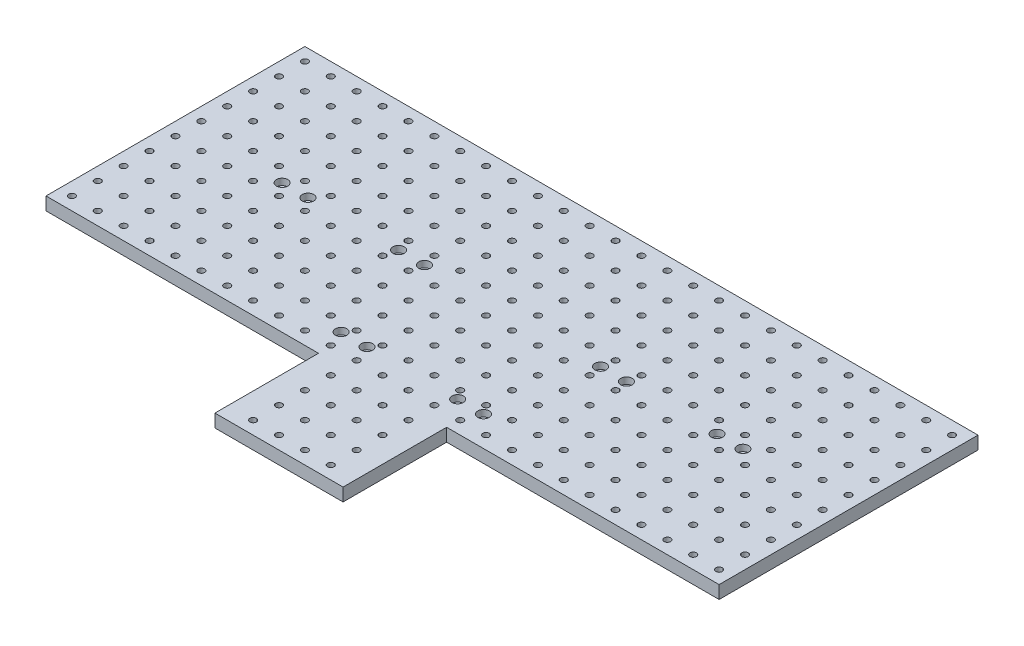
from build123d import *

# Parameters (mm, degrees)
SKETCH1_R           = 3.175
BOSS_EXTRUDE1_DEPTH = 12.7
SKETCH2_R           = 5.588
SKETCH2_R_2         = 3.175
CUT_EXTRUDE1_DEPTH  = 6.35
SKETCH2_2_R         = 3.175
CUT_EXTRUDE2_DEPTH  = 12.7
SKETCH3_R           = 5.588
SKETCH3_R_2         = 3.175
CUT_EXTRUDE3_DEPTH  = 6.35
SKETCH3_2_R         = 3.175
CUT_EXTRUDE4_DEPTH  = 12.7


with BuildPart() as part:
    # Sketch1 → Boss-Extrude1 (new body)
    with BuildSketch(Plane(origin=(0, 0, 0), x_dir=(1, 0, 0), z_dir=(0, 1, 0))):
        Polygon((393.065, 0), (660.4, 0), (660.4, 254), (0, 254), (0, 0), (267.335, 0), (267.335, -101.6), (393.065, -101.6), align=None)
        with Locations((12.7, 241.3)):
            Circle(SKETCH1_R, mode=Mode.SUBTRACT)
        with Locations((38.1, 241.3)):
            Circle(SKETCH1_R, mode=Mode.SUBTRACT)
        with Locations((63.5, 241.3)):
            Circle(SKETCH1_R, mode=Mode.SUBTRACT)
        with Locations((88.9, 241.3)):
            Circle(SKETCH1_R, mode=Mode.SUBTRACT)
        with Locations((114.3, 241.3)):
            Circle(SKETCH1_R, mode=Mode.SUBTRACT)
        with Locations((139.7, 241.3)):
            Circle(SKETCH1_R, mode=Mode.SUBTRACT)
        with Locations((165.1, 241.3)):
            Circle(SKETCH1_R, mode=Mode.SUBTRACT)
        with Locations((190.5, 241.3)):
            Circle(SKETCH1_R, mode=Mode.SUBTRACT)
        with Locations((215.9, 241.3)):
            Circle(SKETCH1_R, mode=Mode.SUBTRACT)
        with Locations((241.3, 241.3)):
            Circle(SKETCH1_R, mode=Mode.SUBTRACT)
        with Locations((266.7, 241.3)):
            Circle(SKETCH1_R, mode=Mode.SUBTRACT)
        with Locations((292.1, 241.3)):
            Circle(SKETCH1_R, mode=Mode.SUBTRACT)
        with Locations((317.5, 241.3)):
            Circle(SKETCH1_R, mode=Mode.SUBTRACT)
        with Locations((342.9, 241.3)):
            Circle(SKETCH1_R, mode=Mode.SUBTRACT)
        with Locations((368.3, 241.3)):
            Circle(SKETCH1_R, mode=Mode.SUBTRACT)
        with Locations((393.7, 241.3)):
            Circle(SKETCH1_R, mode=Mode.SUBTRACT)
        with Locations((419.1, 241.3)):
            Circle(SKETCH1_R, mode=Mode.SUBTRACT)
        with Locations((444.5, 241.3)):
            Circle(SKETCH1_R, mode=Mode.SUBTRACT)
        with Locations((469.9, 241.3)):
            Circle(SKETCH1_R, mode=Mode.SUBTRACT)
        with Locations((495.3, 241.3)):
            Circle(SKETCH1_R, mode=Mode.SUBTRACT)
        with Locations((520.7, 241.3)):
            Circle(SKETCH1_R, mode=Mode.SUBTRACT)
        with Locations((546.1, 241.3)):
            Circle(SKETCH1_R, mode=Mode.SUBTRACT)
        with Locations((571.5, 241.3)):
            Circle(SKETCH1_R, mode=Mode.SUBTRACT)
        with Locations((596.9, 241.3)):
            Circle(SKETCH1_R, mode=Mode.SUBTRACT)
        with Locations((622.3, 241.3)):
            Circle(SKETCH1_R, mode=Mode.SUBTRACT)
        with Locations((647.7, 241.3)):
            Circle(SKETCH1_R, mode=Mode.SUBTRACT)
        with Locations((38.1, 215.9)):
            Circle(SKETCH1_R, mode=Mode.SUBTRACT)
        with Locations((63.5, 215.9)):
            Circle(SKETCH1_R, mode=Mode.SUBTRACT)
        with Locations((88.9, 215.9)):
            Circle(SKETCH1_R, mode=Mode.SUBTRACT)
        with Locations((114.3, 215.9)):
            Circle(SKETCH1_R, mode=Mode.SUBTRACT)
        with Locations((139.7, 215.9)):
            Circle(SKETCH1_R, mode=Mode.SUBTRACT)
        with Locations((165.1, 215.9)):
            Circle(SKETCH1_R, mode=Mode.SUBTRACT)
        with Locations((190.5, 215.9)):
            Circle(SKETCH1_R, mode=Mode.SUBTRACT)
        with Locations((215.9, 215.9)):
            Circle(SKETCH1_R, mode=Mode.SUBTRACT)
        with Locations((241.3, 215.9)):
            Circle(SKETCH1_R, mode=Mode.SUBTRACT)
        with Locations((266.7, 215.9)):
            Circle(SKETCH1_R, mode=Mode.SUBTRACT)
        with Locations((292.1, 215.9)):
            Circle(SKETCH1_R, mode=Mode.SUBTRACT)
        with Locations((317.5, 215.9)):
            Circle(SKETCH1_R, mode=Mode.SUBTRACT)
        with Locations((342.9, 215.9)):
            Circle(SKETCH1_R, mode=Mode.SUBTRACT)
        with Locations((368.3, 215.9)):
            Circle(SKETCH1_R, mode=Mode.SUBTRACT)
        with Locations((393.7, 215.9)):
            Circle(SKETCH1_R, mode=Mode.SUBTRACT)
        with Locations((419.1, 215.9)):
            Circle(SKETCH1_R, mode=Mode.SUBTRACT)
        with Locations((444.5, 215.9)):
            Circle(SKETCH1_R, mode=Mode.SUBTRACT)
        with Locations((469.9, 215.9)):
            Circle(SKETCH1_R, mode=Mode.SUBTRACT)
        with Locations((495.3, 215.9)):
            Circle(SKETCH1_R, mode=Mode.SUBTRACT)
        with Locations((520.7, 215.9)):
            Circle(SKETCH1_R, mode=Mode.SUBTRACT)
        with Locations((546.1, 215.9)):
            Circle(SKETCH1_R, mode=Mode.SUBTRACT)
        with Locations((571.5, 215.9)):
            Circle(SKETCH1_R, mode=Mode.SUBTRACT)
        with Locations((596.9, 215.9)):
            Circle(SKETCH1_R, mode=Mode.SUBTRACT)
        with Locations((622.3, 215.9)):
            Circle(SKETCH1_R, mode=Mode.SUBTRACT)
        with Locations((647.7, 215.9)):
            Circle(SKETCH1_R, mode=Mode.SUBTRACT)
        with Locations((38.1, 190.5)):
            Circle(SKETCH1_R, mode=Mode.SUBTRACT)
        with Locations((63.5, 190.5)):
            Circle(SKETCH1_R, mode=Mode.SUBTRACT)
        with Locations((88.9, 190.5)):
            Circle(SKETCH1_R, mode=Mode.SUBTRACT)
        with Locations((114.3, 190.5)):
            Circle(SKETCH1_R, mode=Mode.SUBTRACT)
        with Locations((139.7, 190.5)):
            Circle(SKETCH1_R, mode=Mode.SUBTRACT)
        with Locations((165.1, 190.5)):
            Circle(SKETCH1_R, mode=Mode.SUBTRACT)
        with Locations((190.5, 190.5)):
            Circle(SKETCH1_R, mode=Mode.SUBTRACT)
        with Locations((215.9, 190.5)):
            Circle(SKETCH1_R, mode=Mode.SUBTRACT)
        with Locations((241.3, 190.5)):
            Circle(SKETCH1_R, mode=Mode.SUBTRACT)
        with Locations((266.7, 190.5)):
            Circle(SKETCH1_R, mode=Mode.SUBTRACT)
        with Locations((292.1, 190.5)):
            Circle(SKETCH1_R, mode=Mode.SUBTRACT)
        with Locations((317.5, 190.5)):
            Circle(SKETCH1_R, mode=Mode.SUBTRACT)
        with Locations((342.9, 190.5)):
            Circle(SKETCH1_R, mode=Mode.SUBTRACT)
        with Locations((368.3, 190.5)):
            Circle(SKETCH1_R, mode=Mode.SUBTRACT)
        with Locations((393.7, 190.5)):
            Circle(SKETCH1_R, mode=Mode.SUBTRACT)
        with Locations((419.1, 190.5)):
            Circle(SKETCH1_R, mode=Mode.SUBTRACT)
        with Locations((444.5, 190.5)):
            Circle(SKETCH1_R, mode=Mode.SUBTRACT)
        with Locations((469.9, 190.5)):
            Circle(SKETCH1_R, mode=Mode.SUBTRACT)
        with Locations((495.3, 190.5)):
            Circle(SKETCH1_R, mode=Mode.SUBTRACT)
        with Locations((520.7, 190.5)):
            Circle(SKETCH1_R, mode=Mode.SUBTRACT)
        with Locations((546.1, 190.5)):
            Circle(SKETCH1_R, mode=Mode.SUBTRACT)
        with Locations((571.5, 190.5)):
            Circle(SKETCH1_R, mode=Mode.SUBTRACT)
        with Locations((596.9, 190.5)):
            Circle(SKETCH1_R, mode=Mode.SUBTRACT)
        with Locations((622.3, 190.5)):
            Circle(SKETCH1_R, mode=Mode.SUBTRACT)
        with Locations((647.7, 190.5)):
            Circle(SKETCH1_R, mode=Mode.SUBTRACT)
        with Locations((38.1, 165.1)):
            Circle(SKETCH1_R, mode=Mode.SUBTRACT)
        with Locations((63.5, 165.1)):
            Circle(SKETCH1_R, mode=Mode.SUBTRACT)
        with Locations((88.9, 165.1)):
            Circle(SKETCH1_R, mode=Mode.SUBTRACT)
        with Locations((114.3, 165.1)):
            Circle(SKETCH1_R, mode=Mode.SUBTRACT)
        with Locations((139.7, 165.1)):
            Circle(SKETCH1_R, mode=Mode.SUBTRACT)
        with Locations((165.1, 165.1)):
            Circle(SKETCH1_R, mode=Mode.SUBTRACT)
        with Locations((190.5, 165.1)):
            Circle(SKETCH1_R, mode=Mode.SUBTRACT)
        with Locations((215.9, 165.1)):
            Circle(SKETCH1_R, mode=Mode.SUBTRACT)
        with Locations((241.3, 165.1)):
            Circle(SKETCH1_R, mode=Mode.SUBTRACT)
        with Locations((266.7, 165.1)):
            Circle(SKETCH1_R, mode=Mode.SUBTRACT)
        with Locations((292.1, 165.1)):
            Circle(SKETCH1_R, mode=Mode.SUBTRACT)
        with Locations((317.5, 165.1)):
            Circle(SKETCH1_R, mode=Mode.SUBTRACT)
        with Locations((342.9, 165.1)):
            Circle(SKETCH1_R, mode=Mode.SUBTRACT)
        with Locations((368.3, 165.1)):
            Circle(SKETCH1_R, mode=Mode.SUBTRACT)
        with Locations((393.7, 165.1)):
            Circle(SKETCH1_R, mode=Mode.SUBTRACT)
        with Locations((419.1, 165.1)):
            Circle(SKETCH1_R, mode=Mode.SUBTRACT)
        with Locations((444.5, 165.1)):
            Circle(SKETCH1_R, mode=Mode.SUBTRACT)
        with Locations((469.9, 165.1)):
            Circle(SKETCH1_R, mode=Mode.SUBTRACT)
        with Locations((495.3, 165.1)):
            Circle(SKETCH1_R, mode=Mode.SUBTRACT)
        with Locations((520.7, 165.1)):
            Circle(SKETCH1_R, mode=Mode.SUBTRACT)
        with Locations((546.1, 165.1)):
            Circle(SKETCH1_R, mode=Mode.SUBTRACT)
        with Locations((571.5, 165.1)):
            Circle(SKETCH1_R, mode=Mode.SUBTRACT)
        with Locations((596.9, 165.1)):
            Circle(SKETCH1_R, mode=Mode.SUBTRACT)
        with Locations((622.3, 165.1)):
            Circle(SKETCH1_R, mode=Mode.SUBTRACT)
        with Locations((647.7, 165.1)):
            Circle(SKETCH1_R, mode=Mode.SUBTRACT)
        with Locations((38.1, 139.7)):
            Circle(SKETCH1_R, mode=Mode.SUBTRACT)
        with Locations((63.5, 139.7)):
            Circle(SKETCH1_R, mode=Mode.SUBTRACT)
        with Locations((88.9, 139.7)):
            Circle(SKETCH1_R, mode=Mode.SUBTRACT)
        with Locations((114.3, 139.7)):
            Circle(SKETCH1_R, mode=Mode.SUBTRACT)
        with Locations((139.7, 139.7)):
            Circle(SKETCH1_R, mode=Mode.SUBTRACT)
        with Locations((165.1, 139.7)):
            Circle(SKETCH1_R, mode=Mode.SUBTRACT)
        with Locations((190.5, 139.7)):
            Circle(SKETCH1_R, mode=Mode.SUBTRACT)
        with Locations((215.9, 139.7)):
            Circle(SKETCH1_R, mode=Mode.SUBTRACT)
        with Locations((241.3, 139.7)):
            Circle(SKETCH1_R, mode=Mode.SUBTRACT)
        with Locations((266.7, 139.7)):
            Circle(SKETCH1_R, mode=Mode.SUBTRACT)
        with Locations((292.1, 139.7)):
            Circle(SKETCH1_R, mode=Mode.SUBTRACT)
        with Locations((317.5, 139.7)):
            Circle(SKETCH1_R, mode=Mode.SUBTRACT)
        with Locations((342.9, 139.7)):
            Circle(SKETCH1_R, mode=Mode.SUBTRACT)
        with Locations((368.3, 139.7)):
            Circle(SKETCH1_R, mode=Mode.SUBTRACT)
        with Locations((393.7, 139.7)):
            Circle(SKETCH1_R, mode=Mode.SUBTRACT)
        with Locations((419.1, 139.7)):
            Circle(SKETCH1_R, mode=Mode.SUBTRACT)
        with Locations((444.5, 139.7)):
            Circle(SKETCH1_R, mode=Mode.SUBTRACT)
        with Locations((469.9, 139.7)):
            Circle(SKETCH1_R, mode=Mode.SUBTRACT)
        with Locations((495.3, 139.7)):
            Circle(SKETCH1_R, mode=Mode.SUBTRACT)
        with Locations((520.7, 139.7)):
            Circle(SKETCH1_R, mode=Mode.SUBTRACT)
        with Locations((546.1, 139.7)):
            Circle(SKETCH1_R, mode=Mode.SUBTRACT)
        with Locations((571.5, 139.7)):
            Circle(SKETCH1_R, mode=Mode.SUBTRACT)
        with Locations((596.9, 139.7)):
            Circle(SKETCH1_R, mode=Mode.SUBTRACT)
        with Locations((622.3, 139.7)):
            Circle(SKETCH1_R, mode=Mode.SUBTRACT)
        with Locations((647.7, 139.7)):
            Circle(SKETCH1_R, mode=Mode.SUBTRACT)
        with Locations((38.1, 114.3)):
            Circle(SKETCH1_R, mode=Mode.SUBTRACT)
        with Locations((63.5, 114.3)):
            Circle(SKETCH1_R, mode=Mode.SUBTRACT)
        with Locations((88.9, 114.3)):
            Circle(SKETCH1_R, mode=Mode.SUBTRACT)
        with Locations((114.3, 114.3)):
            Circle(SKETCH1_R, mode=Mode.SUBTRACT)
        with Locations((139.7, 114.3)):
            Circle(SKETCH1_R, mode=Mode.SUBTRACT)
        with Locations((165.1, 114.3)):
            Circle(SKETCH1_R, mode=Mode.SUBTRACT)
        with Locations((190.5, 114.3)):
            Circle(SKETCH1_R, mode=Mode.SUBTRACT)
        with Locations((215.9, 114.3)):
            Circle(SKETCH1_R, mode=Mode.SUBTRACT)
        with Locations((241.3, 114.3)):
            Circle(SKETCH1_R, mode=Mode.SUBTRACT)
        with Locations((266.7, 114.3)):
            Circle(SKETCH1_R, mode=Mode.SUBTRACT)
        with Locations((292.1, 114.3)):
            Circle(SKETCH1_R, mode=Mode.SUBTRACT)
        with Locations((317.5, 114.3)):
            Circle(SKETCH1_R, mode=Mode.SUBTRACT)
        with Locations((342.9, 114.3)):
            Circle(SKETCH1_R, mode=Mode.SUBTRACT)
        with Locations((368.3, 114.3)):
            Circle(SKETCH1_R, mode=Mode.SUBTRACT)
        with Locations((393.7, 114.3)):
            Circle(SKETCH1_R, mode=Mode.SUBTRACT)
        with Locations((419.1, 114.3)):
            Circle(SKETCH1_R, mode=Mode.SUBTRACT)
        with Locations((444.5, 114.3)):
            Circle(SKETCH1_R, mode=Mode.SUBTRACT)
        with Locations((469.9, 114.3)):
            Circle(SKETCH1_R, mode=Mode.SUBTRACT)
        with Locations((495.3, 114.3)):
            Circle(SKETCH1_R, mode=Mode.SUBTRACT)
        with Locations((520.7, 114.3)):
            Circle(SKETCH1_R, mode=Mode.SUBTRACT)
        with Locations((546.1, 114.3)):
            Circle(SKETCH1_R, mode=Mode.SUBTRACT)
        with Locations((571.5, 114.3)):
            Circle(SKETCH1_R, mode=Mode.SUBTRACT)
        with Locations((596.9, 114.3)):
            Circle(SKETCH1_R, mode=Mode.SUBTRACT)
        with Locations((622.3, 114.3)):
            Circle(SKETCH1_R, mode=Mode.SUBTRACT)
        with Locations((647.7, 114.3)):
            Circle(SKETCH1_R, mode=Mode.SUBTRACT)
        with Locations((38.1, 88.9)):
            Circle(SKETCH1_R, mode=Mode.SUBTRACT)
        with Locations((63.5, 88.9)):
            Circle(SKETCH1_R, mode=Mode.SUBTRACT)
        with Locations((88.9, 88.9)):
            Circle(SKETCH1_R, mode=Mode.SUBTRACT)
        with Locations((114.3, 88.9)):
            Circle(SKETCH1_R, mode=Mode.SUBTRACT)
        with Locations((139.7, 88.9)):
            Circle(SKETCH1_R, mode=Mode.SUBTRACT)
        with Locations((165.1, 88.9)):
            Circle(SKETCH1_R, mode=Mode.SUBTRACT)
        with Locations((190.5, 88.9)):
            Circle(SKETCH1_R, mode=Mode.SUBTRACT)
        with Locations((215.9, 88.9)):
            Circle(SKETCH1_R, mode=Mode.SUBTRACT)
        with Locations((241.3, 88.9)):
            Circle(SKETCH1_R, mode=Mode.SUBTRACT)
        with Locations((266.7, 88.9)):
            Circle(SKETCH1_R, mode=Mode.SUBTRACT)
        with Locations((292.1, 88.9)):
            Circle(SKETCH1_R, mode=Mode.SUBTRACT)
        with Locations((317.5, 88.9)):
            Circle(SKETCH1_R, mode=Mode.SUBTRACT)
        with Locations((342.9, 88.9)):
            Circle(SKETCH1_R, mode=Mode.SUBTRACT)
        with Locations((368.3, 88.9)):
            Circle(SKETCH1_R, mode=Mode.SUBTRACT)
        with Locations((393.7, 88.9)):
            Circle(SKETCH1_R, mode=Mode.SUBTRACT)
        with Locations((419.1, 88.9)):
            Circle(SKETCH1_R, mode=Mode.SUBTRACT)
        with Locations((444.5, 88.9)):
            Circle(SKETCH1_R, mode=Mode.SUBTRACT)
        with Locations((469.9, 88.9)):
            Circle(SKETCH1_R, mode=Mode.SUBTRACT)
        with Locations((495.3, 88.9)):
            Circle(SKETCH1_R, mode=Mode.SUBTRACT)
        with Locations((520.7, 88.9)):
            Circle(SKETCH1_R, mode=Mode.SUBTRACT)
        with Locations((546.1, 88.9)):
            Circle(SKETCH1_R, mode=Mode.SUBTRACT)
        with Locations((571.5, 88.9)):
            Circle(SKETCH1_R, mode=Mode.SUBTRACT)
        with Locations((596.9, 88.9)):
            Circle(SKETCH1_R, mode=Mode.SUBTRACT)
        with Locations((622.3, 88.9)):
            Circle(SKETCH1_R, mode=Mode.SUBTRACT)
        with Locations((647.7, 88.9)):
            Circle(SKETCH1_R, mode=Mode.SUBTRACT)
        with Locations((38.1, 63.5)):
            Circle(SKETCH1_R, mode=Mode.SUBTRACT)
        with Locations((63.5, 63.5)):
            Circle(SKETCH1_R, mode=Mode.SUBTRACT)
        with Locations((88.9, 63.5)):
            Circle(SKETCH1_R, mode=Mode.SUBTRACT)
        with Locations((114.3, 63.5)):
            Circle(SKETCH1_R, mode=Mode.SUBTRACT)
        with Locations((139.7, 63.5)):
            Circle(SKETCH1_R, mode=Mode.SUBTRACT)
        with Locations((165.1, 63.5)):
            Circle(SKETCH1_R, mode=Mode.SUBTRACT)
        with Locations((190.5, 63.5)):
            Circle(SKETCH1_R, mode=Mode.SUBTRACT)
        with Locations((215.9, 63.5)):
            Circle(SKETCH1_R, mode=Mode.SUBTRACT)
        with Locations((241.3, 63.5)):
            Circle(SKETCH1_R, mode=Mode.SUBTRACT)
        with Locations((266.7, 63.5)):
            Circle(SKETCH1_R, mode=Mode.SUBTRACT)
        with Locations((292.1, 63.5)):
            Circle(SKETCH1_R, mode=Mode.SUBTRACT)
        with Locations((317.5, 63.5)):
            Circle(SKETCH1_R, mode=Mode.SUBTRACT)
        with Locations((342.9, 63.5)):
            Circle(SKETCH1_R, mode=Mode.SUBTRACT)
        with Locations((368.3, 63.5)):
            Circle(SKETCH1_R, mode=Mode.SUBTRACT)
        with Locations((393.7, 63.5)):
            Circle(SKETCH1_R, mode=Mode.SUBTRACT)
        with Locations((419.1, 63.5)):
            Circle(SKETCH1_R, mode=Mode.SUBTRACT)
        with Locations((444.5, 63.5)):
            Circle(SKETCH1_R, mode=Mode.SUBTRACT)
        with Locations((469.9, 63.5)):
            Circle(SKETCH1_R, mode=Mode.SUBTRACT)
        with Locations((495.3, 63.5)):
            Circle(SKETCH1_R, mode=Mode.SUBTRACT)
        with Locations((520.7, 63.5)):
            Circle(SKETCH1_R, mode=Mode.SUBTRACT)
        with Locations((546.1, 63.5)):
            Circle(SKETCH1_R, mode=Mode.SUBTRACT)
        with Locations((571.5, 63.5)):
            Circle(SKETCH1_R, mode=Mode.SUBTRACT)
        with Locations((596.9, 63.5)):
            Circle(SKETCH1_R, mode=Mode.SUBTRACT)
        with Locations((622.3, 63.5)):
            Circle(SKETCH1_R, mode=Mode.SUBTRACT)
        with Locations((647.7, 63.5)):
            Circle(SKETCH1_R, mode=Mode.SUBTRACT)
        with Locations((38.1, 38.1)):
            Circle(SKETCH1_R, mode=Mode.SUBTRACT)
        with Locations((63.5, 38.1)):
            Circle(SKETCH1_R, mode=Mode.SUBTRACT)
        with Locations((88.9, 38.1)):
            Circle(SKETCH1_R, mode=Mode.SUBTRACT)
        with Locations((114.3, 38.1)):
            Circle(SKETCH1_R, mode=Mode.SUBTRACT)
        with Locations((139.7, 38.1)):
            Circle(SKETCH1_R, mode=Mode.SUBTRACT)
        with Locations((165.1, 38.1)):
            Circle(SKETCH1_R, mode=Mode.SUBTRACT)
        with Locations((190.5, 38.1)):
            Circle(SKETCH1_R, mode=Mode.SUBTRACT)
        with Locations((215.9, 38.1)):
            Circle(SKETCH1_R, mode=Mode.SUBTRACT)
        with Locations((241.3, 38.1)):
            Circle(SKETCH1_R, mode=Mode.SUBTRACT)
        with Locations((266.7, 38.1)):
            Circle(SKETCH1_R, mode=Mode.SUBTRACT)
        with Locations((292.1, 38.1)):
            Circle(SKETCH1_R, mode=Mode.SUBTRACT)
        with Locations((317.5, 38.1)):
            Circle(SKETCH1_R, mode=Mode.SUBTRACT)
        with Locations((342.9, 38.1)):
            Circle(SKETCH1_R, mode=Mode.SUBTRACT)
        with Locations((368.3, 38.1)):
            Circle(SKETCH1_R, mode=Mode.SUBTRACT)
        with Locations((393.7, 38.1)):
            Circle(SKETCH1_R, mode=Mode.SUBTRACT)
        with Locations((419.1, 38.1)):
            Circle(SKETCH1_R, mode=Mode.SUBTRACT)
        with Locations((444.5, 38.1)):
            Circle(SKETCH1_R, mode=Mode.SUBTRACT)
        with Locations((469.9, 38.1)):
            Circle(SKETCH1_R, mode=Mode.SUBTRACT)
        with Locations((495.3, 38.1)):
            Circle(SKETCH1_R, mode=Mode.SUBTRACT)
        with Locations((520.7, 38.1)):
            Circle(SKETCH1_R, mode=Mode.SUBTRACT)
        with Locations((546.1, 38.1)):
            Circle(SKETCH1_R, mode=Mode.SUBTRACT)
        with Locations((571.5, 38.1)):
            Circle(SKETCH1_R, mode=Mode.SUBTRACT)
        with Locations((596.9, 38.1)):
            Circle(SKETCH1_R, mode=Mode.SUBTRACT)
        with Locations((622.3, 38.1)):
            Circle(SKETCH1_R, mode=Mode.SUBTRACT)
        with Locations((647.7, 38.1)):
            Circle(SKETCH1_R, mode=Mode.SUBTRACT)
        with Locations((38.1, 12.7)):
            Circle(SKETCH1_R, mode=Mode.SUBTRACT)
        with Locations((63.5, 12.7)):
            Circle(SKETCH1_R, mode=Mode.SUBTRACT)
        with Locations((88.9, 12.7)):
            Circle(SKETCH1_R, mode=Mode.SUBTRACT)
        with Locations((114.3, 12.7)):
            Circle(SKETCH1_R, mode=Mode.SUBTRACT)
        with Locations((139.7, 12.7)):
            Circle(SKETCH1_R, mode=Mode.SUBTRACT)
        with Locations((165.1, 12.7)):
            Circle(SKETCH1_R, mode=Mode.SUBTRACT)
        with Locations((190.5, 12.7)):
            Circle(SKETCH1_R, mode=Mode.SUBTRACT)
        with Locations((215.9, 12.7)):
            Circle(SKETCH1_R, mode=Mode.SUBTRACT)
        with Locations((241.3, 12.7)):
            Circle(SKETCH1_R, mode=Mode.SUBTRACT)
        with Locations((266.7, 12.7)):
            Circle(SKETCH1_R, mode=Mode.SUBTRACT)
        with Locations((292.1, 12.7)):
            Circle(SKETCH1_R, mode=Mode.SUBTRACT)
        with Locations((317.5, 12.7)):
            Circle(SKETCH1_R, mode=Mode.SUBTRACT)
        with Locations((342.9, 12.7)):
            Circle(SKETCH1_R, mode=Mode.SUBTRACT)
        with Locations((368.3, 12.7)):
            Circle(SKETCH1_R, mode=Mode.SUBTRACT)
        with Locations((393.7, 12.7)):
            Circle(SKETCH1_R, mode=Mode.SUBTRACT)
        with Locations((419.1, 12.7)):
            Circle(SKETCH1_R, mode=Mode.SUBTRACT)
        with Locations((444.5, 12.7)):
            Circle(SKETCH1_R, mode=Mode.SUBTRACT)
        with Locations((469.9, 12.7)):
            Circle(SKETCH1_R, mode=Mode.SUBTRACT)
        with Locations((495.3, 12.7)):
            Circle(SKETCH1_R, mode=Mode.SUBTRACT)
        with Locations((520.7, 12.7)):
            Circle(SKETCH1_R, mode=Mode.SUBTRACT)
        with Locations((546.1, 12.7)):
            Circle(SKETCH1_R, mode=Mode.SUBTRACT)
        with Locations((571.5, 12.7)):
            Circle(SKETCH1_R, mode=Mode.SUBTRACT)
        with Locations((596.9, 12.7)):
            Circle(SKETCH1_R, mode=Mode.SUBTRACT)
        with Locations((622.3, 12.7)):
            Circle(SKETCH1_R, mode=Mode.SUBTRACT)
        with Locations((647.7, 12.7)):
            Circle(SKETCH1_R, mode=Mode.SUBTRACT)
        with Locations((292.1, -12.7)):
            Circle(SKETCH1_R, mode=Mode.SUBTRACT)
        with Locations((317.5, -12.7)):
            Circle(SKETCH1_R, mode=Mode.SUBTRACT)
        with Locations((342.9, -12.7)):
            Circle(SKETCH1_R, mode=Mode.SUBTRACT)
        with Locations((368.3, -12.7)):
            Circle(SKETCH1_R, mode=Mode.SUBTRACT)
        with Locations((292.1, -38.1)):
            Circle(SKETCH1_R, mode=Mode.SUBTRACT)
        with Locations((317.5, -38.1)):
            Circle(SKETCH1_R, mode=Mode.SUBTRACT)
        with Locations((342.9, -38.1)):
            Circle(SKETCH1_R, mode=Mode.SUBTRACT)
        with Locations((368.3, -38.1)):
            Circle(SKETCH1_R, mode=Mode.SUBTRACT)
        with Locations((292.1, -63.5)):
            Circle(SKETCH1_R, mode=Mode.SUBTRACT)
        with Locations((317.5, -63.5)):
            Circle(SKETCH1_R, mode=Mode.SUBTRACT)
        with Locations((342.9, -63.5)):
            Circle(SKETCH1_R, mode=Mode.SUBTRACT)
        with Locations((368.3, -63.5)):
            Circle(SKETCH1_R, mode=Mode.SUBTRACT)
        with Locations((292.1, -88.9)):
            Circle(SKETCH1_R, mode=Mode.SUBTRACT)
        with Locations((317.5, -88.9)):
            Circle(SKETCH1_R, mode=Mode.SUBTRACT)
        with Locations((342.9, -88.9)):
            Circle(SKETCH1_R, mode=Mode.SUBTRACT)
        with Locations((368.3, -88.9)):
            Circle(SKETCH1_R, mode=Mode.SUBTRACT)
        with Locations((12.7, 215.9)):
            Circle(SKETCH1_R, mode=Mode.SUBTRACT)
        with Locations((12.7, 190.5)):
            Circle(SKETCH1_R, mode=Mode.SUBTRACT)
        with Locations((12.7, 165.1)):
            Circle(SKETCH1_R, mode=Mode.SUBTRACT)
        with Locations((12.7, 139.7)):
            Circle(SKETCH1_R, mode=Mode.SUBTRACT)
        with Locations((12.7, 114.3)):
            Circle(SKETCH1_R, mode=Mode.SUBTRACT)
        with Locations((12.7, 88.9)):
            Circle(SKETCH1_R, mode=Mode.SUBTRACT)
        with Locations((12.7, 63.5)):
            Circle(SKETCH1_R, mode=Mode.SUBTRACT)
        with Locations((12.7, 38.1)):
            Circle(SKETCH1_R, mode=Mode.SUBTRACT)
        with Locations((12.7, 12.7)):
            Circle(SKETCH1_R, mode=Mode.SUBTRACT)
    extrude(amount=BOSS_EXTRUDE1_DEPTH)

    # Sketch2 → Cut-Extrude1 (cut)
    # profile 1 of 8: a face of its own
    with BuildSketch(Plane(origin=(0, 12.7, 0), x_dir=(1, 0, 0), z_dir=(0, 1, 0))):
        with Locations((531.368, 127)):
            Circle(SKETCH2_R)
        with Locations((531.368, 127)):
            Circle(SKETCH2_R_2, mode=Mode.SUBTRACT)
    # profile 2 of 8: a face of its own
    with BuildSketch(Plane(origin=(0, 12.7, 0), x_dir=(1, 0, 0), z_dir=(0, 1, 0))):
        with Locations((556.768, 127)):
            Circle(SKETCH2_R)
        with Locations((556.768, 127)):
            Circle(SKETCH2_R_2, mode=Mode.SUBTRACT)
    # profile 3 of 8: a face of its own
    with BuildSketch(Plane(origin=(0, 12.7, 0), x_dir=(1, 0, 0), z_dir=(0, 1, 0))):
        with Locations((442.468, 127)):
            Circle(SKETCH2_R)
        with Locations((442.468, 127)):
            Circle(SKETCH2_R_2, mode=Mode.SUBTRACT)
    # profile 4 of 8: a face of its own
    with BuildSketch(Plane(origin=(0, 12.7, 0), x_dir=(1, 0, 0), z_dir=(0, 1, 0))):
        with Locations((417.068, 127)):
            Circle(SKETCH2_R)
        with Locations((417.068, 127)):
            Circle(SKETCH2_R_2, mode=Mode.SUBTRACT)
    # profile 5 of 8: a face of its own
    with BuildSketch(Plane(origin=(0, 12.7, 0), x_dir=(1, 0, 0), z_dir=(0, 1, 0))):
        with Locations((104.648, 127)):
            Circle(SKETCH2_R)
        with Locations((104.648, 127)):
            Circle(SKETCH2_R_2, mode=Mode.SUBTRACT)
    # profile 6 of 8: a face of its own
    with BuildSketch(Plane(origin=(0, 12.7, 0), x_dir=(1, 0, 0), z_dir=(0, 1, 0))):
        with Locations((130.048, 127)):
            Circle(SKETCH2_R)
        with Locations((130.048, 127)):
            Circle(SKETCH2_R_2, mode=Mode.SUBTRACT)
    # profile 7 of 8: a face of its own
    with BuildSketch(Plane(origin=(0, 12.7, 0), x_dir=(1, 0, 0), z_dir=(0, 1, 0))):
        with Locations((218.948, 127)):
            Circle(SKETCH2_R)
        with Locations((218.948, 127)):
            Circle(SKETCH2_R_2, mode=Mode.SUBTRACT)
    # profile 8 of 8: a face of its own
    with BuildSketch(Plane(origin=(0, 12.7, 0), x_dir=(1, 0, 0), z_dir=(0, 1, 0))):
        with Locations((244.348, 127)):
            Circle(SKETCH2_R)
        with Locations((244.348, 127)):
            Circle(SKETCH2_R_2, mode=Mode.SUBTRACT)
    extrude(amount=-CUT_EXTRUDE1_DEPTH, mode=Mode.SUBTRACT)

    # Sketch2<2> → Cut-Extrude2 (cut)
    with BuildSketch(Plane(origin=(0, 12.7, 0), x_dir=(1, 0, 0), z_dir=(0, 1, 0))):
        with Locations((531.368, 127)):
            Circle(SKETCH2_2_R)
        with Locations((556.768, 127)):
            Circle(SKETCH2_2_R)
        with Locations((442.468, 127)):
            Circle(SKETCH2_2_R)
        with Locations((417.068, 127)):
            Circle(SKETCH2_2_R)
        with Locations((104.648, 127)):
            Circle(SKETCH2_2_R)
        with Locations((130.048, 127)):
            Circle(SKETCH2_2_R)
        with Locations((218.948, 127)):
            Circle(SKETCH2_2_R)
        with Locations((244.348, 127)):
            Circle(SKETCH2_2_R)
    extrude(amount=-CUT_EXTRUDE2_DEPTH, mode=Mode.SUBTRACT)

    # Sketch3 → Cut-Extrude3 (cut)
    # profile 1 of 4: a face of its own
    with BuildSketch(Plane(origin=(0, 12.7, 0), x_dir=(1, 0, 0), z_dir=(0, 1, 0))):
        with Locations((260.35, 29.21)):
            Circle(SKETCH3_R)
        with Locations((260.35, 29.21)):
            Circle(SKETCH3_R_2, mode=Mode.SUBTRACT)
    # profile 2 of 4: a face of its own
    with BuildSketch(Plane(origin=(0, 12.7, 0), x_dir=(1, 0, 0), z_dir=(0, 1, 0))):
        with Locations((285.75, 29.21)):
            Circle(SKETCH3_R)
        with Locations((285.75, 29.21)):
            Circle(SKETCH3_R_2, mode=Mode.SUBTRACT)
    # profile 3 of 4: a face of its own
    with BuildSketch(Plane(origin=(0, 12.7, 0), x_dir=(1, 0, 0), z_dir=(0, 1, 0))):
        with Locations((374.65, 29.21)):
            Circle(SKETCH3_R)
        with Locations((374.65, 29.21)):
            Circle(SKETCH3_R_2, mode=Mode.SUBTRACT)
    # profile 4 of 4: a face of its own
    with BuildSketch(Plane(origin=(0, 12.7, 0), x_dir=(1, 0, 0), z_dir=(0, 1, 0))):
        with Locations((400.05, 29.21)):
            Circle(SKETCH3_R)
        with Locations((400.05, 29.21)):
            Circle(SKETCH3_R_2, mode=Mode.SUBTRACT)
    extrude(amount=-CUT_EXTRUDE3_DEPTH, mode=Mode.SUBTRACT)

    # Sketch3<2> → Cut-Extrude4 (cut)
    with BuildSketch(Plane(origin=(0, 12.7, 0), x_dir=(1, 0, 0), z_dir=(0, 1, 0))):
        with Locations((260.35, 29.21)):
            Circle(SKETCH3_2_R)
        with Locations((285.75, 29.21)):
            Circle(SKETCH3_2_R)
        with Locations((374.65, 29.21)):
            Circle(SKETCH3_2_R)
        with Locations((400.05, 29.21)):
            Circle(SKETCH3_2_R)
    extrude(amount=-CUT_EXTRUDE4_DEPTH, mode=Mode.SUBTRACT)


solid = part.part
